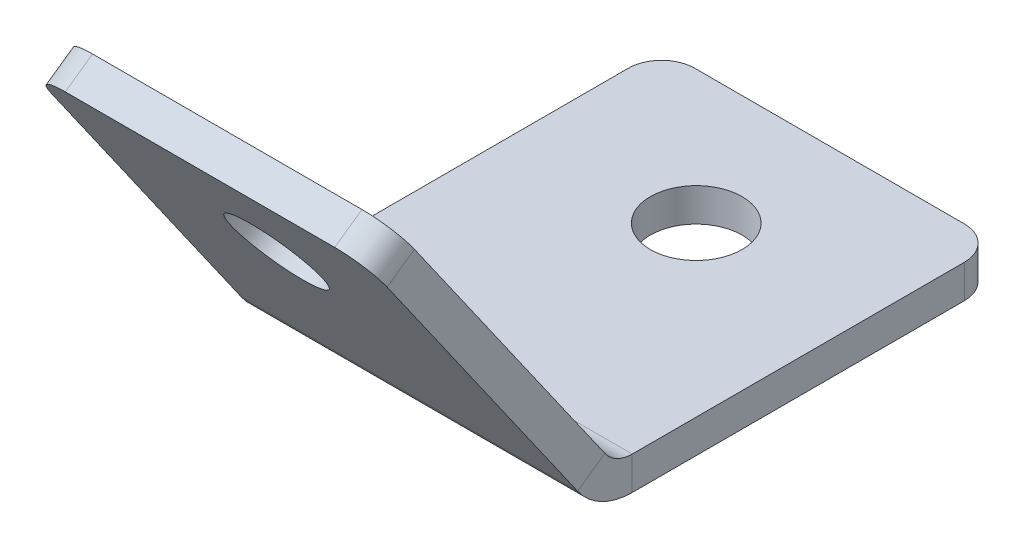
from build123d import *

# Parameters (mm, degrees)
BASE_FLANGE1_DEPTH = 32.004
SKETCH6_R          = 4.3688
CUT_EXTRUDE1_DEPTH = 60.723526665
SKETCH7_R          = 4.3688
CUT_EXTRUDE2_DEPTH = 60.723526665
FILLET1_R          = 3.175


# Sheet-metal steps are written as plain solids
with BuildPart() as part:
    # Sketch1 → Base-Flange1 (new body)
    with BuildSketch(Plane(origin=(0, 0, 0), x_dir=(0, 0, -1), z_dir=(1, 0, 0))):
        with BuildLine():
            Line((38.1, 0), (3.305600771, 0))
            ThreePointArc((3.305600771, 0), (0.373497077, 0.717481209), (-1.89601471, 2.707789629))
            Line((-1.89601471, 2.707789629), (-21.853262225, 31.209692887))
            Line((-21.853262225, 31.209692887), (-19.252454484, 33.030798073))
            Line((-19.252454484, 33.030798073), (0.70479303, 4.528894815))
            ThreePointArc((0.70479303, 4.528894815), (1.839548924, 3.533740605), (3.305600771, 3.175))
            Line((3.305600771, 3.175), (38.1, 3.175))
            Line((38.1, 3.175), (38.1, 0))
        make_face()
    extrude(amount=BASE_FLANGE1_DEPTH)

    # Sketch6 → Cut-Extrude1 (cut, through all)
    with BuildSketch(Plane(origin=(0, 0, 0), x_dir=(1, 0, 0), z_dir=(0, -0.5735764363510502, 0.819152044288989))):
        with Locations(Location((16.002, 25.4, 0), (0, 0, 270))):
            Circle(SKETCH6_R)
    extrude(amount=-CUT_EXTRUDE1_DEPTH, mode=Mode.SUBTRACT)

    # Sketch7 → Cut-Extrude2 (cut, through all)
    with BuildSketch(Plane.XZ):
        with Locations(Location((16.002, -25.4, 0), (0, 0, 270))):
            Circle(SKETCH7_R)
    extrude(amount=-CUT_EXTRUDE2_DEPTH, mode=Mode.SUBTRACT)

    # Fillet1
    fillet1_edges = [part.edges().sort_by_distance(p)[0] for p in [
        (32.004, 32.12024548, 20.552858355),
        (0, 32.12024548, 20.552858355),
        (32.004, 1.5875, -38.1),
        (0, 1.5875, -38.1),
    ]]
    fillet(fillet1_edges, radius=FILLET1_R)


solid = part.part
